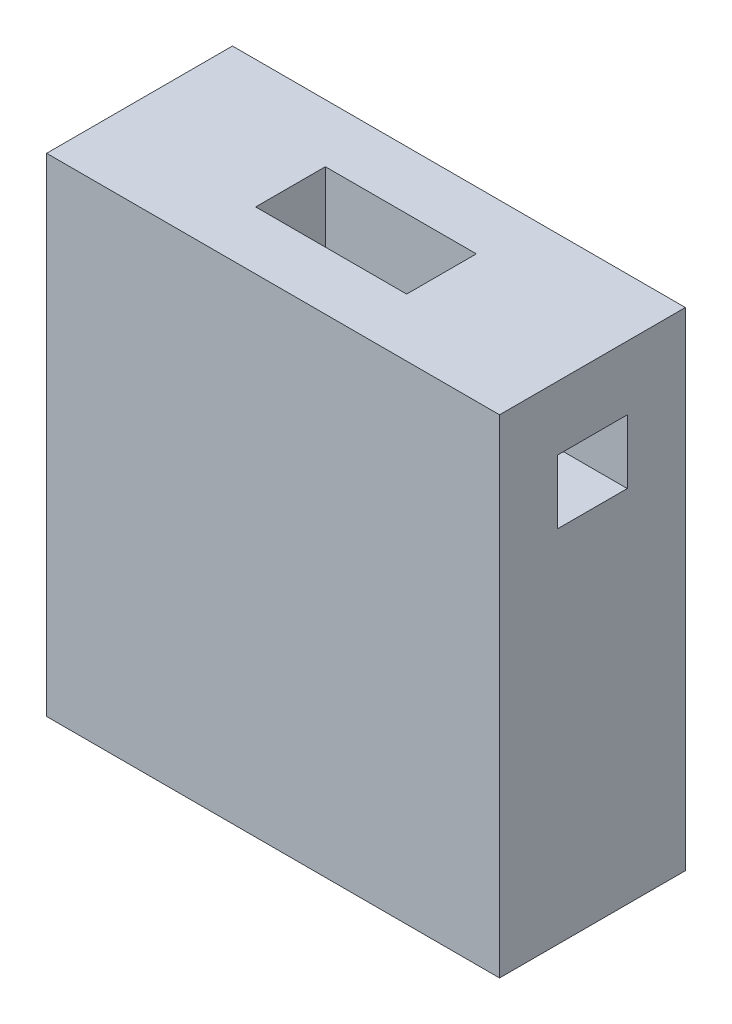
from build123d import *

# Parameters (mm, degrees)
ESQUISSE1_W             = 39
ESQUISSE1_H             = 16
BOSS_EXTRU_1_DEPTH      = 42
ESQUISSE2_W             = 13
ESQUISSE2_H             = 6
ENL_V_MAT_EXTRU_1_DEPTH = 11
ESQUISSE3_W             = 6
ESQUISSE3_H             = 5.5
ENL_V_MAT_EXTRU_2_DEPTH = 51.039984013


with BuildPart() as part:
    # Esquisse1 → Boss.-Extru.1 (new body)
    with BuildSketch(Plane(origin=(0, 0, 0), x_dir=(1, 0, 0), z_dir=(0, 1, 0))):
        Rectangle(ESQUISSE1_W, ESQUISSE1_H)
    extrude(amount=BOSS_EXTRU_1_DEPTH)

    # Esquisse2 → Enlèv. mat.-Extru.1 (cut)
    with BuildSketch(Plane(origin=(0, 42, 0), x_dir=(1, 0, 0), z_dir=(0, 1, 0))):
        Rectangle(ESQUISSE2_W, ESQUISSE2_H)
    extrude(amount=-ENL_V_MAT_EXTRU_1_DEPTH, mode=Mode.SUBTRACT)

    # Esquisse3 → Enlèv. mat.-Extru.2 (cut, through all)
    with BuildSketch(Plane(origin=(-6.5, 0, 0), x_dir=(0, 0, -1), z_dir=(1, 0, 0))):
        with Locations((0, 33.75)):
            Rectangle(ESQUISSE3_W, ESQUISSE3_H)
    extrude(amount=ENL_V_MAT_EXTRU_2_DEPTH, mode=Mode.SUBTRACT)


solid = part.part
